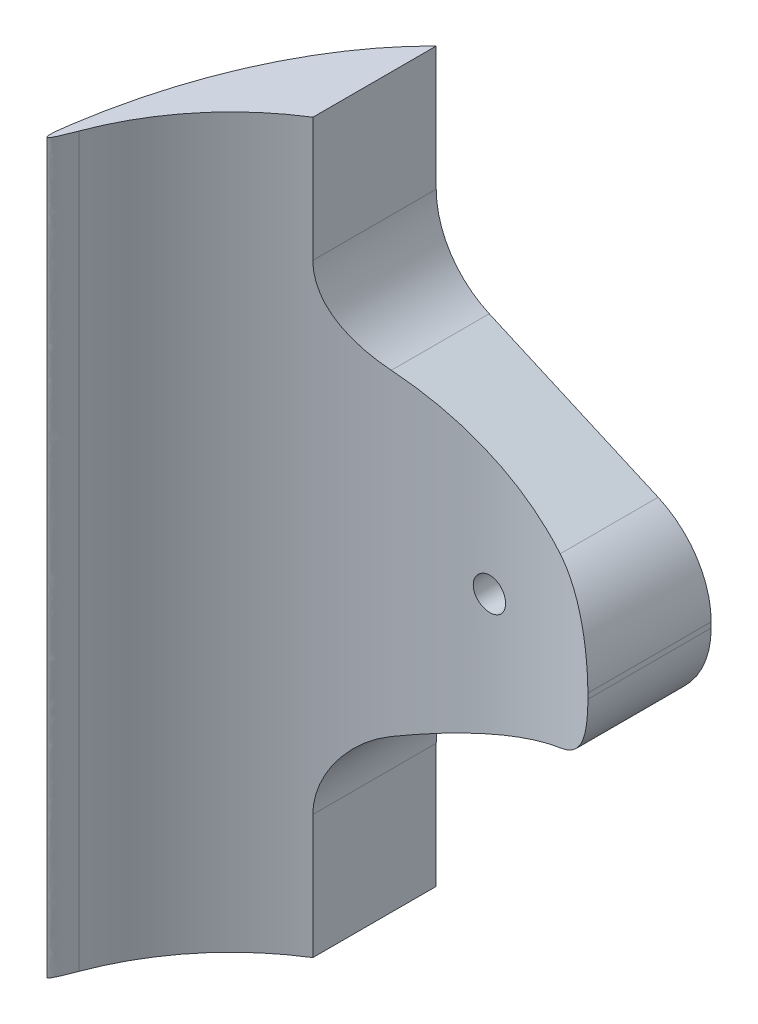
from build123d import *
from OCP.BRepAlgoAPI import BRepAlgoAPI_Cut
from OCP.TopTools import TopTools_ListOfShape

# Parameters (mm, degrees)
BOSS_EXTRUDE1_DEPTH = 45
FILLET1_START       = -1
FILLET1_DEPTH       = 47
SKETCH2_R           = 1
CUT_EXTRUDE3_DEPTH  = 30


with BuildPart() as part:
    # Sketch1 → Boss-Extrude1 (new body)
    with BuildSketch(Plane(origin=(0, 0, 0), x_dir=(1, 0, 0), z_dir=(0, 1, 0))):
        with BuildLine():
            add(Edge.make_bspline(
                [(-8.5, 21.180377675), (-16, 13.832083379), (-16, 0)],
                knots=[0.560075306, 0.560075306, 0.560075306, 1.570796327, 1.570796327, 1.570796327], degree=2, weights=[1, 0.875, 1]))
            ThreePointArc((-16, 0), (0, 16), (16, 0))
            add(Edge.make_bspline(
                [(16, 0), (16, 13.832083379), (8.5, 21.180377675)],
                knots=[4.71238898, 4.71238898, 4.71238898, 5.723110001, 5.723110001, 5.723110001], degree=2, weights=[1, 0.875, 1]))
            Line((8.5, 21.180377675), (-8.5, 21.180377675))
        make_face()
    extrude(amount=BOSS_EXTRUDE1_DEPTH)


with BuildPart() as fillet1_tool:
    # Fillet1: read off the stored shape, not the designer's step
    # Fillet1 outline → Fillet1 (new body)
    with BuildSketch(Plane(origin=(0, 0, 0), x_dir=(1, 0, 0), z_dir=(0, 1, 0)).offset(FILLET1_START)):
        with BuildLine():
            ThreePointArc((-16, 0), (-15.747238962, 2.832748677), (-14.996941867, 5.575996291))
            add(Edge.make_bspline(
                [(-14.996941867, 5.575996291), (-16.005804346, 2.862606405), (-15.574790718, 5.72521281)],
                knots=[0, 0, 0, 1, 1, 1], degree=2))
            add(Edge.make_bspline(
                [(-15.574790718, 5.72521281), (-16, 2.901156362), (-16, 0)],
                knots=[1.335570419, 1.335570419, 1.335570419, 1.570796327, 1.570796327, 1.570796327], degree=2, weights=[0.955358207, 0.97090865, 1]))
        make_face()
        with BuildLine():
            add(Edge.make_bspline(
                [(15.574790718, 5.72521281), (16.005804346, 2.862606405), (14.996941867, 5.575996291)],
                knots=[0, 0, 0, 1, 1, 1], degree=2))
            ThreePointArc((14.996941867, 5.575996291), (15.747238962, 2.832748677), (16, 0))
            add(Edge.make_bspline(
                [(16, 0), (16, 2.901156362), (15.574790718, 5.72521281)],
                knots=[4.71238898, 4.71238898, 4.71238898, 4.947614888, 4.947614888, 4.947614888], degree=2, weights=[1, 0.97090865, 0.955358207]))
        make_face()
    extrude(amount=FILLET1_DEPTH)


with BuildPart() as part_1:
    add(part.part)

    # Fillet1: cut by fillet1_tool, with a tolerance
    fillet1_stock = TopTools_ListOfShape()
    fillet1_stock.Append(part_1.part.wrapped)
    fillet1_tools = TopTools_ListOfShape()
    fillet1_tools.Append(fillet1_tool.part.wrapped)
    fillet1_cut = BRepAlgoAPI_Cut()
    fillet1_cut.SetArguments(fillet1_stock)
    fillet1_cut.SetTools(fillet1_tools)
    fillet1_cut.SetFuzzyValue(0.00001)
    fillet1_cut.Build()
    add(Compound.cast(fillet1_cut.Shape()).solids(), mode=Mode.REPLACE)

    # Sketch2 → Cut-Extrude3 (cut)
    # profile 1 of 6: a face of its own
    with BuildSketch(Plane(origin=(0, 0, -21.180377675), x_dir=(-1, 0, 0), z_dir=(0, 0, -1))):
        Polygon((-8.5, 22.33499841), (-8.5, 22.66500159), (-8.5, 45), (-34.986586565, 45), (-34.986586565, 0), (-8.5, 0), align=None)
    # profile 2 of 6: a face of its own
    with BuildSketch(Plane(origin=(0, 0, -21.180377675), x_dir=(-1, 0, 0), z_dir=(0, 0, -1))):
        with BuildLine():
            ThreePointArc((-8.5, 22.66500159), (-7.607608721, 25.668323397), (-5.220021136, 27.697049499))
            Line((-5.220021136, 27.697049499), (5.220021136, 32.302950501))
            ThreePointArc((5.220021136, 32.302950501), (7.607608721, 34.331676603), (8.5, 37.33499841))
            Line((8.5, 37.33499841), (8.5, 45))
            Line((8.5, 45), (-8.5, 45))
            Line((-8.5, 45), (-8.5, 22.66500159))
        make_face()
        with Locations((0, 37.5)):
            Circle(SKETCH2_R, mode=Mode.SUBTRACT)
    # profile 3 of 6: a face of its own
    with BuildSketch(Plane(origin=(0, 0, -21.180377675), x_dir=(-1, 0, 0), z_dir=(0, 0, -1))):
        with Locations((0, 37.5)):
            Circle(SKETCH2_R)
    # profile 4 of 6: a face of its own
    with BuildSketch(Plane(origin=(0, 0, -21.180377675), x_dir=(-1, 0, 0), z_dir=(0, 0, -1))):
        with Locations((0, 22.5)):
            Circle(SKETCH2_R)
    # profile 5 of 6: a face of its own
    with BuildSketch(Plane(origin=(0, 0, -21.180377675), x_dir=(-1, 0, 0), z_dir=(0, 0, -1))):
        with BuildLine():
            ThreePointArc((-5.220021136, 17.302950501), (-7.607608721, 19.331676603), (-8.5, 22.33499841))
            Line((-8.5, 22.33499841), (-8.5, 0))
            Line((-8.5, 0), (8.5, 0))
            Line((8.5, 0), (8.5, 7.66500159))
            ThreePointArc((8.5, 7.66500159), (7.607608721, 10.668323397), (5.220021136, 12.697049499))
            Line((5.220021136, 12.697049499), (-5.220021136, 17.302950501))
        make_face()
        with Locations((0, 7.5)):
            Circle(SKETCH2_R, mode=Mode.SUBTRACT)
    # profile 6 of 6: a face of its own
    with BuildSketch(Plane(origin=(0, 0, -21.180377675), x_dir=(-1, 0, 0), z_dir=(0, 0, -1))):
        with Locations((0, 7.5)):
            Circle(SKETCH2_R)
    extrude(amount=-CUT_EXTRUDE3_DEPTH, mode=Mode.SUBTRACT)


solid = part_1.part
